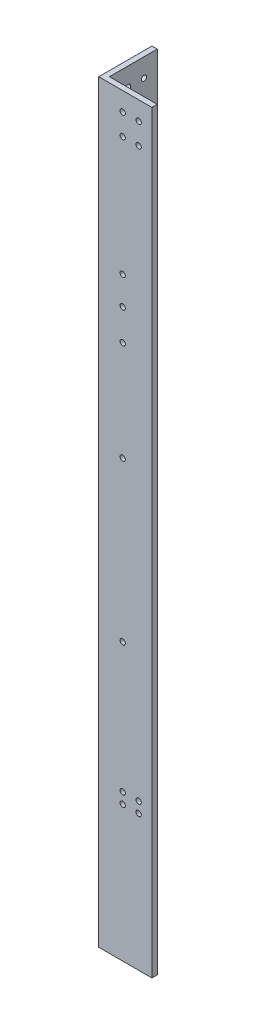
from build123d import *

# Parameters (mm, degrees)
BOSS_EXTRUDE1_DEPTH               = 450
FRONTSIDEHOLES_SKETCH3_R          = 1.5875
FRONTSIDEHOLES_CUT_EXTRUDE1_DEPTH = 3.175
LEFTSIDEHOLES_SKETCH4_R           = 1.5875
LEFTSIDEHOLES_CUT_EXTRUDE2_DEPTH  = 3.175


with BuildPart() as part:
    # Sketch2 → Boss-Extrude1 (new body)
    with BuildSketch(Plane(origin=(0, 0, 0), x_dir=(1, 0, 0), z_dir=(0, 1, 0))):
        Polygon((0, 31.75), (3.175, 31.75), (3.175, 3.175), (31.75, 3.175), (31.75, 0), (0, 0), align=None)
    extrude(amount=BOSS_EXTRUDE1_DEPTH)

    # FrontSideHoles-Sketch3 → FrontSideHoles-Cut-Extrude1 (cut)
    with BuildSketch(Plane.XY):
        with Locations((14.2875, 81.1125)):
            Circle(FRONTSIDEHOLES_SKETCH3_R)
        with Locations((23.8125, 81.1125)):
            Circle(FRONTSIDEHOLES_SKETCH3_R)
        with Locations((14.2875, 87.4625)):
            Circle(FRONTSIDEHOLES_SKETCH3_R)
        with Locations((23.8125, 87.4625)):
            Circle(FRONTSIDEHOLES_SKETCH3_R)
        with Locations((14.2875, 438.8875)):
            Circle(FRONTSIDEHOLES_SKETCH3_R)
        with Locations((14.2875, 426.1875)):
            Circle(FRONTSIDEHOLES_SKETCH3_R)
        with Locations((23.8125, 438.8875)):
            Circle(FRONTSIDEHOLES_SKETCH3_R)
        with Locations((23.8125, 426.1875)):
            Circle(FRONTSIDEHOLES_SKETCH3_R)
        with Locations((14.2875, 338.177644)):
            Circle(FRONTSIDEHOLES_SKETCH3_R)
        with Locations((14.2875, 319.652644)):
            Circle(FRONTSIDEHOLES_SKETCH3_R)
        with Locations((14.2875, 260)):
            Circle(FRONTSIDEHOLES_SKETCH3_R)
        with Locations((14.2875, 165)):
            Circle(FRONTSIDEHOLES_SKETCH3_R)
        with Locations((14.2875, 355)):
            Circle(FRONTSIDEHOLES_SKETCH3_R)
    extrude(amount=-FRONTSIDEHOLES_CUT_EXTRUDE1_DEPTH, mode=Mode.SUBTRACT)

    # LeftSideHoles-Sketch4 → LeftSideHoles-Cut-Extrude2 (cut)
    with BuildSketch(Plane.ZY):
        with Locations((-23.8125, 81.1125)):
            Circle(LEFTSIDEHOLES_SKETCH4_R)
        with Locations((-14.2875, 81.1125)):
            Circle(LEFTSIDEHOLES_SKETCH4_R)
        with Locations((-23.8125, 87.4625)):
            Circle(LEFTSIDEHOLES_SKETCH4_R)
        with Locations((-14.2875, 87.4625)):
            Circle(LEFTSIDEHOLES_SKETCH4_R)
        with Locations((-23.8125, 438.8875)):
            Circle(LEFTSIDEHOLES_SKETCH4_R)
        with Locations((-14.2875, 438.8875)):
            Circle(LEFTSIDEHOLES_SKETCH4_R)
        with Locations((-23.8125, 426.1875)):
            Circle(LEFTSIDEHOLES_SKETCH4_R)
        with Locations((-14.2875, 426.1875)):
            Circle(LEFTSIDEHOLES_SKETCH4_R)
        with Locations((-23.8125, 332.602644)):
            Circle(LEFTSIDEHOLES_SKETCH4_R)
        with Locations((-14.2875, 332.602644)):
            Circle(LEFTSIDEHOLES_SKETCH4_R)
        with Locations((-23.8125, 319.902644)):
            Circle(LEFTSIDEHOLES_SKETCH4_R)
        with Locations((-14.2875, 319.902644)):
            Circle(LEFTSIDEHOLES_SKETCH4_R)
        with Locations((-23.8125, 7.9375)):
            Circle(LEFTSIDEHOLES_SKETCH4_R)
        with Locations((-14.2875, 7.9375)):
            Circle(LEFTSIDEHOLES_SKETCH4_R)
    extrude(amount=-LEFTSIDEHOLES_CUT_EXTRUDE2_DEPTH, mode=Mode.SUBTRACT)


solid = part.part
